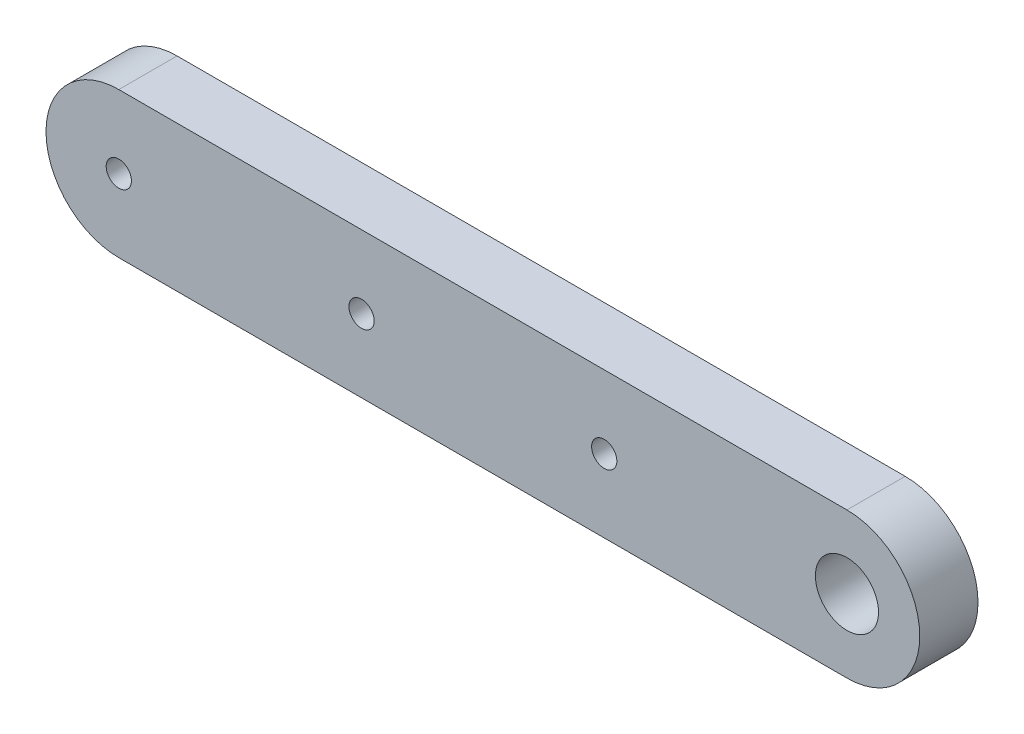
from build123d import *

# Parameters (mm, degrees)
BOSS_EXTRUDE1_DEPTH = 6
SKETCH2_R           = 1.3
CUT_EXTRUDE1_DEPTH  = 84.057209199
LPATTERN1_COUNT     = 4
LPATTERN1_PITCH     = 25
SKETCH3_R           = 3.25
CUT_EXTRUDE2_DEPTH  = 84.057209199


with BuildPart() as part:
    # Sketch1 → Boss-Extrude1 (new body)
    with BuildSketch(Plane.XY):
        with BuildLine():
            Line((75, 7.5), (0, 7.5))
            ThreePointArc((0, 7.5), (-7.5, 0), (0, -7.5))
            Line((0, -7.5), (75, -7.5))
            ThreePointArc((75, -7.5), (82.5, 0), (75, 7.5))
        make_face()
    extrude(amount=BOSS_EXTRUDE1_DEPTH)

    # Sketch2 → Cut-Extrude1 (cut, through all)
    with BuildSketch(Plane.XY.offset(6)):
        Circle(SKETCH2_R)
        with Locations((75, 0)):
            Circle(SKETCH2_R)
    cut_extrude1 = extrude(amount=-CUT_EXTRUDE1_DEPTH, mode=Mode.SUBTRACT)

    # LPattern1: Cut-Extrude1 ×4
    with Locations(*[(i * LPATTERN1_PITCH, 0, 0) for i in range(1, LPATTERN1_COUNT)]):
        add(cut_extrude1, mode=Mode.SUBTRACT)

    # Sketch3 → Cut-Extrude2 (cut, through all)
    with BuildSketch(Plane.XY.offset(6)):
        with Locations((75, 0)):
            Circle(SKETCH3_R)
    extrude(amount=-CUT_EXTRUDE2_DEPTH, mode=Mode.SUBTRACT)


solid = part.part
